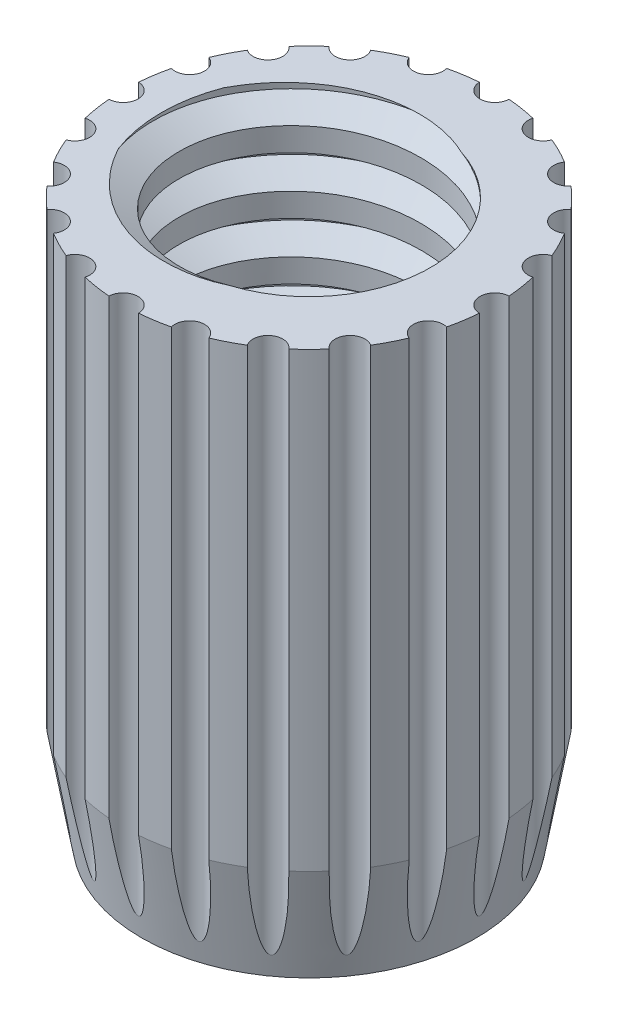
from build123d import *

# Parameters (mm, degrees)
SKETCH1_R                    = 5
BOSS_EXTRUDE1_DEPTH          = 15
F_5_16_18_TAPPED_HOLE1_D     = 6.5278
F_5_16_18_TAPPED_HOLE1_DEPTH = 10
F_5_16_18_TAPPED_HOLE1_TIP   = 1.961148974
CHAMFER1_SIZE                = 0.5
CHAMFER1_SIZE2               = 2.83564091
SKETCH5_R                    = 0.4
CUT_EXTRUDE2_DEPTH           = 17.583123952
CUT_SWEEP4_PITCH             = 1.53


with BuildPart() as part:
    # Sketch1 → Boss-Extrude1 (new body)
    with BuildSketch(Plane(origin=(0, 0, 0), x_dir=(1, 0, 0), z_dir=(0, 1, 0))):
        with Locations(Location((0, 0, 0), (0, 0, 270))):
            Circle(SKETCH1_R)
    extrude(amount=BOSS_EXTRUDE1_DEPTH)

    # 5/16-18 Tapped Hole1
    with Locations(Plane(origin=(0, 15, 0), x_dir=(1, 0, 0), z_dir=(0, 1, 0))):
        with Locations((0, 0)):
            Hole(F_5_16_18_TAPPED_HOLE1_D / 2, depth=F_5_16_18_TAPPED_HOLE1_DEPTH)
            with Locations((0, 0, -(F_5_16_18_TAPPED_HOLE1_DEPTH + F_5_16_18_TAPPED_HOLE1_TIP / 2))):  # 118° drill point
                Cone(0, F_5_16_18_TAPPED_HOLE1_D / 2, F_5_16_18_TAPPED_HOLE1_TIP, mode=Mode.SUBTRACT)

    # Cut-Loft1: read off the stored shape, not the designer's step
    # Cut-Loft1 outline → Cut-Loft1 (revolve, cut)
    with BuildSketch(Plane.XY):
        Polygon((2.5, 0), (3.2639, 5), (0, 3.038851026), (0, 0), align=None)
    revolve(axis=Axis((0, 0, 0), (0, 1, 0)), mode=Mode.SUBTRACT)

    # Chamfer1
    chamfer1_edges = [part.edges().sort_by_distance(p)[0] for p in [
        (0, 0, -5),
    ]]
    chamfer1_side = [part.faces().sort_by_distance(p)[0] for p in [
        (0, 0, -4.858578644),
    ]]
    chamfer(chamfer1_edges, length=CHAMFER1_SIZE, length2=CHAMFER1_SIZE2, reference=chamfer1_side[0])

    # Sketch5 → Cut-Extrude2 (cut, through all)
    with BuildSketch(Plane(origin=(0, 15, 0), x_dir=(1, 0, 0), z_dir=(0, 1, 0))):
        with Locations((0, 5)):
            Circle(SKETCH5_R)
        with Locations((1.545084972, 4.755282581)):
            Circle(SKETCH5_R)
        with Locations((2.938926261, 4.045084972)):
            Circle(SKETCH5_R)
        with Locations((4.045084972, 2.938926261)):
            Circle(SKETCH5_R)
        with Locations((4.755282581, 1.545084972)):
            Circle(SKETCH5_R)
        with Locations((5, 0)):
            Circle(SKETCH5_R)
        with Locations((4.755282581, -1.545084972)):
            Circle(SKETCH5_R)
        with Locations((4.045084972, -2.938926261)):
            Circle(SKETCH5_R)
        with Locations((2.938926261, -4.045084972)):
            Circle(SKETCH5_R)
        with Locations((1.545084972, -4.755282581)):
            Circle(SKETCH5_R)
        with Locations((0, -5)):
            Circle(SKETCH5_R)
        with Locations((-1.545084972, -4.755282581)):
            Circle(SKETCH5_R)
        with Locations((-2.938926261, -4.045084972)):
            Circle(SKETCH5_R)
        with Locations((-4.045084972, -2.938926261)):
            Circle(SKETCH5_R)
        with Locations((-4.755282581, -1.545084972)):
            Circle(SKETCH5_R)
        with Locations((-5, 0)):
            Circle(SKETCH5_R)
        with Locations((-4.755282581, 1.545084972)):
            Circle(SKETCH5_R)
        with Locations((-4.045084972, 2.938926261)):
            Circle(SKETCH5_R)
        with Locations((-2.938926261, 4.045084972)):
            Circle(SKETCH5_R)
        with Locations((-1.545084972, 4.755282581)):
            Circle(SKETCH5_R)
    extrude(amount=-CUT_EXTRUDE2_DEPTH, mode=Mode.SUBTRACT)

    # Cut-Sweep4: arcs per turn and ends read off the stored shape
    # Cut-Sweep4: the profile of Sketch6 screwed along a right-hand helix through 7 turns, 8 arcs to a turn; built about Z, then put on its axis
    cut_sweep4_z = Axis((0, 0, 0), (0, 0, 1))
    cut_sweep4_corners = [(3.115153208, 0, -2.220694444), (3.115153208, 0, -1.867916667), (3.981293208, 0, -1.426944444), (3.981293208, 0, -1.250555556), (3.115153208, 0, -0.809583333), (3.115153208, 0, -0.456805556), (0.012543208, 0, -0.456805556), (0.012543208, 0, -2.220694444)]
    with BuildLine(mode=Mode.PRIVATE) as cut_sweep4_profile:
        Line(cut_sweep4_corners[0], cut_sweep4_corners[1])
        Line(cut_sweep4_corners[1], cut_sweep4_corners[2])
        Line(cut_sweep4_corners[2], cut_sweep4_corners[3])
        Line(cut_sweep4_corners[3], cut_sweep4_corners[4])
        Line(cut_sweep4_corners[4], cut_sweep4_corners[5])
        Line(cut_sweep4_corners[5], cut_sweep4_corners[6])
        Line(cut_sweep4_corners[6], cut_sweep4_corners[7])
        Line(cut_sweep4_corners[7], cut_sweep4_corners[0])
    cut_sweep4_cap = Face(cut_sweep4_profile.wire())
    cut_sweep4_turn_angles = [0, 22.5, 45, 67.5, 90, 112.5, 135, 157.5, 180, 202.5, 225, 247.5, 270, 292.5, 315, 337.5, 360]
    cut_sweep4_turn_weights = [1, 0.9238795325112867, 1, 0.9238795325112867, 1, 0.9238795325112867, 1, 0.9238795325112867, 1, 0.9238795325112867, 1, 0.9238795325112867, 1, 0.9238795325112867, 1, 0.9238795325112867, 1]
    cut_sweep4_turn_rails = [Edge.make_bspline([Vector(p[0], p[1], 0).rotate(cut_sweep4_z, cut_sweep4_turn_angles[k]) / cut_sweep4_turn_weights[k] + Vector(0, 0, p[2] + CUT_SWEEP4_PITCH * cut_sweep4_turn_angles[k] / 360) for k in range(17)], [0, 0, 0, 1, 1, 2, 2, 3, 3, 4, 4, 5, 5, 6, 6, 7, 7, 8, 8, 8], 2, cut_sweep4_turn_weights) for p in cut_sweep4_corners]
    cut_sweep4_turn_sides = [Face.make_surface_from_curves(cut_sweep4_turn_rails[p[0]], cut_sweep4_turn_rails[p[1]]) for p in [(0, 1), (1, 2), (2, 3), (3, 4), (4, 5), (5, 6), (6, 7), (7, 0)]]
    cut_sweep4_turn = Solid(Shell([*cut_sweep4_turn_sides, cut_sweep4_cap, cut_sweep4_cap.rotate(cut_sweep4_z, 360).moved(Location((0, 0, CUT_SWEEP4_PITCH * 360 / 360)))]))
    cut_sweep4_each = [*[cut_sweep4_turn.moved(Location((0, 0, CUT_SWEEP4_PITCH * i))) for i in range(7)]]
    add(Plane(origin=(0.012543208, 15, 0), x_dir=(-0.7071067811865537, 0, -0.7071067811865415), z_dir=(0, -1, 0)) * Compound([cut_sweep4_each[i] for i in range(0, 7, 2)]), mode=Mode.SUBTRACT)
    add(Plane(origin=(0.012543208, 15, 0), x_dir=(-0.7071067811865537, 0, -0.7071067811865415), z_dir=(0, -1, 0)) * Compound([cut_sweep4_each[i] for i in range(1, 7, 2)]), mode=Mode.SUBTRACT)


solid = part.part
